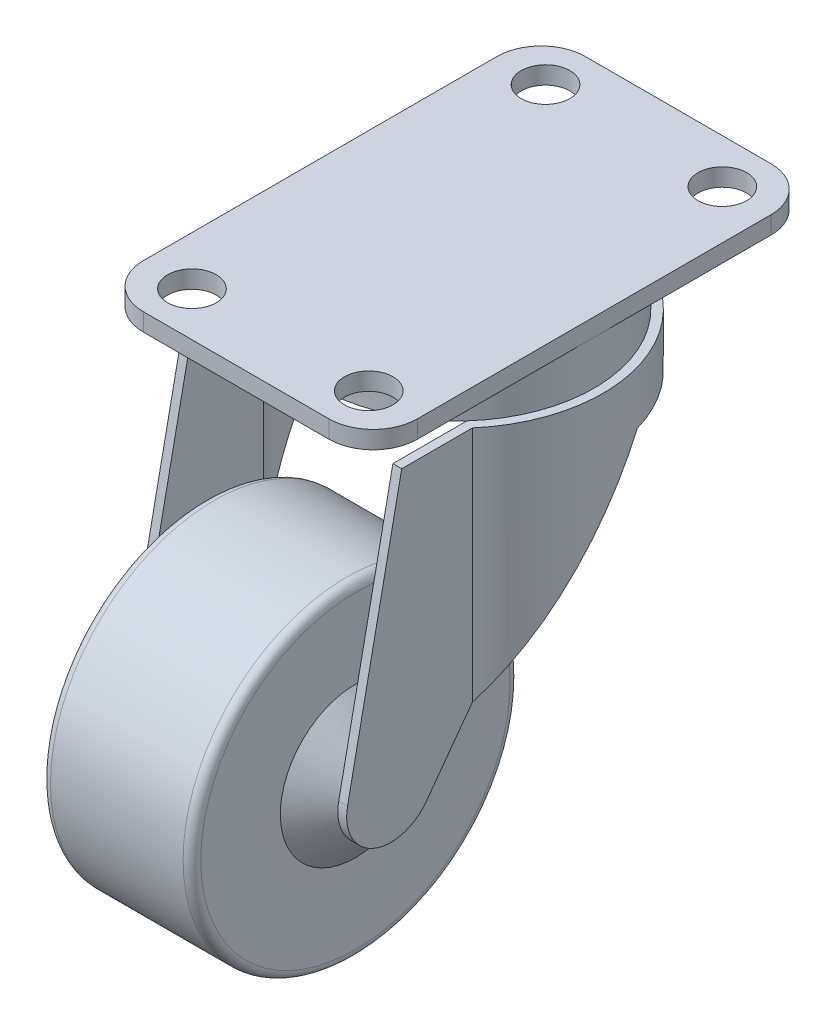
from build123d import *
from build123d.topology import SkipClean

# Parameters (mm, degrees)
SKETCH_1_R               = 2.75
EXTRUDE_1_DEPTH          = 2
SKETCH_2_R               = 15.5
EXTRUDE_2_DEPTH          = 5
EXTRUDE_3_DEPTH          = 36
CUT_EXTRUDE_3_DEPTH      = 51.776470929
CUT_EXTRUDE_3_DEPTH_BACK = 51.776470929
SKETCH_5_W               = 23
SKETCH_5_H               = 8.40054282
CUT_EXTRUDE_4_DEPTH      = 66.986741092
SKETCH_6_R               = 18.5
EXTRUDE_4_DEPTH          = 8.5
FILLET_1_R               = 1
SKETCH_8_R               = 5
SKETCH_7_R               = 8.5
EXTRUDE_START            = -0.169697322
EXTRUDE_5_OUTLINE_R      = 2.5
EXTRUDE_5_DEPTH          = 0.169697322


# Read off the part's stored shape, not the designer's step: ﾎﾞｽ - 押し出し5
with BuildPart() as part:
    # ｽｹｯﾁ1 → ﾎﾞｽ - 押し出し1 (new body)
    with BuildSketch(Plane(origin=(0, 0, 0), x_dir=(1, 0, 0), z_dir=(0, 1, 0))):
        with BuildLine():
            Line((-10.5, -25), (10.5, -25))
            ThreePointArc((10.5, -25), (14.035533906, -23.535533906), (15.5, -20))
            Line((15.5, -20), (15.5, 20))
            ThreePointArc((15.5, 20), (14.035533906, 23.535533906), (10.5, 25))
            Line((10.5, 25), (-10.5, 25))
            ThreePointArc((-10.5, 25), (-14.035533906, 23.535533906), (-15.5, 20))
            Line((-15.5, 20), (-15.5, -20))
            ThreePointArc((-15.5, -20), (-14.035533906, -23.535533906), (-10.5, -25))
        make_face()
        with Locations(Location((-10, 20, 0), (0, 0, 270))):
            Circle(SKETCH_1_R, mode=Mode.SUBTRACT)
        with Locations(Location((10, 20, 0), (0, 0, 270))):
            Circle(SKETCH_1_R, mode=Mode.SUBTRACT)
        with Locations(Location((-10, -20, 0), (0, 0, 270))):
            Circle(SKETCH_1_R, mode=Mode.SUBTRACT)
        with Locations(Location((10, -20, 0), (0, 0, 270))):
            Circle(SKETCH_1_R, mode=Mode.SUBTRACT)
    extrude(amount=EXTRUDE_1_DEPTH)

    # ｽｹｯﾁ2 → ﾎﾞｽ - 押し出し2 (add)
    with BuildSketch(Plane.XZ):
        with Locations(Location((0, 0, 0), (0, 0, 180))):
            Circle(SKETCH_2_R)
    extrude(amount=EXTRUDE_2_DEPTH)


with BuildPart() as body_2:
    # ｽｹｯﾁ3 → ﾎﾞｽ - 押し出し3 (new body)
    with BuildSketch(Plane.XZ.offset(5)):
        with BuildLine():
            Line((-12.5, 25), (12.5, 25))
            Line((12.5, 25), (12.5, 10.770329614))
            ThreePointArc((12.5, 10.770329614), (0, -16.5), (-12.5, 10.770329614))
            Line((-12.5, 10.770329614), (-12.5, 25))
        make_face()
        with BuildLine():
            Line((11.5, 24), (11.5, 10.392304845))
            ThreePointArc((11.5, 10.392304845), (0, -15.5), (-11.5, 10.392304845))
            Line((-11.5, 10.392304845), (-11.5, 24))
            Line((-11.5, 24), (11.5, 24))
        make_face(mode=Mode.SUBTRACT)
    extrude(amount=EXTRUDE_3_DEPTH)

    # ｽｹｯﾁ4 → ｶｯﾄ - 押し出し3 (cut, two sides: drawn at the far end of the back side and taken through both)
    with BuildSketch(Plane(origin=(0, 0, 0), x_dir=(0, 0, -1), z_dir=(1, 0, 0)).offset(-CUT_EXTRUDE_3_DEPTH_BACK)):
        with BuildLine():
            Line((16.5, -11), (4.5, -11))
            Line((4.5, -11), (-15.96565758, -38.953655572))
            ThreePointArc((-15.96565758, -38.953655572), (-22.023908538, -40.572066735), (-24.898821811, -34.999227868))
            Line((-24.898821811, -34.999227868), (-18.770329614, -5))
            Line((-18.770329614, -5), (-25, -5))
            Line((-25, -5), (-26, -5))
            Line((-26, -5), (-26, -42))
            Line((-26, -42), (17.5, -42))
            Line((17.5, -42), (17.5, -11))
            Line((17.5, -11), (16.5, -11))
        make_face()
    extrude(amount=CUT_EXTRUDE_3_DEPTH + CUT_EXTRUDE_3_DEPTH_BACK, mode=Mode.SUBTRACT)

    # ｽｹｯﾁ5 → ｶｯﾄ - 押し出し4 (cut, through all)
    with BuildSketch(Plane(origin=(0, 0, 24), x_dir=(-1, 0, 0), z_dir=(0, 0, -1))):
        with Locations((0, -34.79972859)):
            Rectangle(SKETCH_5_W, SKETCH_5_H)
    extrude(amount=-CUT_EXTRUDE_4_DEPTH, mode=Mode.SUBTRACT)



with BuildPart() as body_3:
    # ｽｹｯﾁ6 → ﾎﾞｽ - 押し出し4 (new, symmetric)
    with BuildSketch(Plane(origin=(0, 0, 0), x_dir=(0, 0, -1), z_dir=(1, 0, 0))):
        with Locations((-20, -36)):
            Circle(SKETCH_6_R)
    extrude(amount=EXTRUDE_4_DEPTH, both=True)

    # ﾌｨﾚｯﾄ1
    fillet_1_edges = [body_3.edges().sort_by_distance(p)[0] for p in [
        (-8.5, -36, 38.5),
        (8.5, -36, 38.5),
    ]]
    fillet(fillet_1_edges, radius=FILLET_1_R)


with BuildPart() as body_2_1:
    add(body_2.part)

    add(body_3.part)  # ﾛﾌﾄ1 merges body 3
    # ｽｹｯﾁ8 → ﾛﾌﾄ1 section 0
    with BuildSketch(Plane.ZY.offset(-11.5)):
        with Locations((20, -36)):
            Circle(SKETCH_8_R)
    # ｽｹｯﾁ7 → ﾛﾌﾄ1 section 1
    with BuildSketch(Plane(origin=(8.5, 0, 0), x_dir=(0, 0, -1), z_dir=(1, 0, 0))):
        with Locations((-20, -36)):
            Circle(SKETCH_7_R)
    loft_1 = loft()

    # ﾐﾗｰ1: ﾛﾌﾄ1 across plane
    add(loft_1.mirror(Plane(origin=(0, 0, 0), x_dir=(0, 0, 1), z_dir=(1, 0, 0))))

    # ﾎﾞｽ - 押し出し5 outline → ﾎﾞｽ - 押し出し5 (add)
    with SkipClean():  # the faces are left unmerged after this step: merging them gives an invalid solid
        with BuildSketch(Plane(origin=(0, -54.5, 0), x_dir=(-1, 0, 0), z_dir=(0, -1, 0)).offset(EXTRUDE_START)):
            with Locations((0, -20)):
                Circle(EXTRUDE_5_OUTLINE_R)
        extrude(amount=EXTRUDE_5_DEPTH)


solid = Compound([part.part, body_2_1.part])
